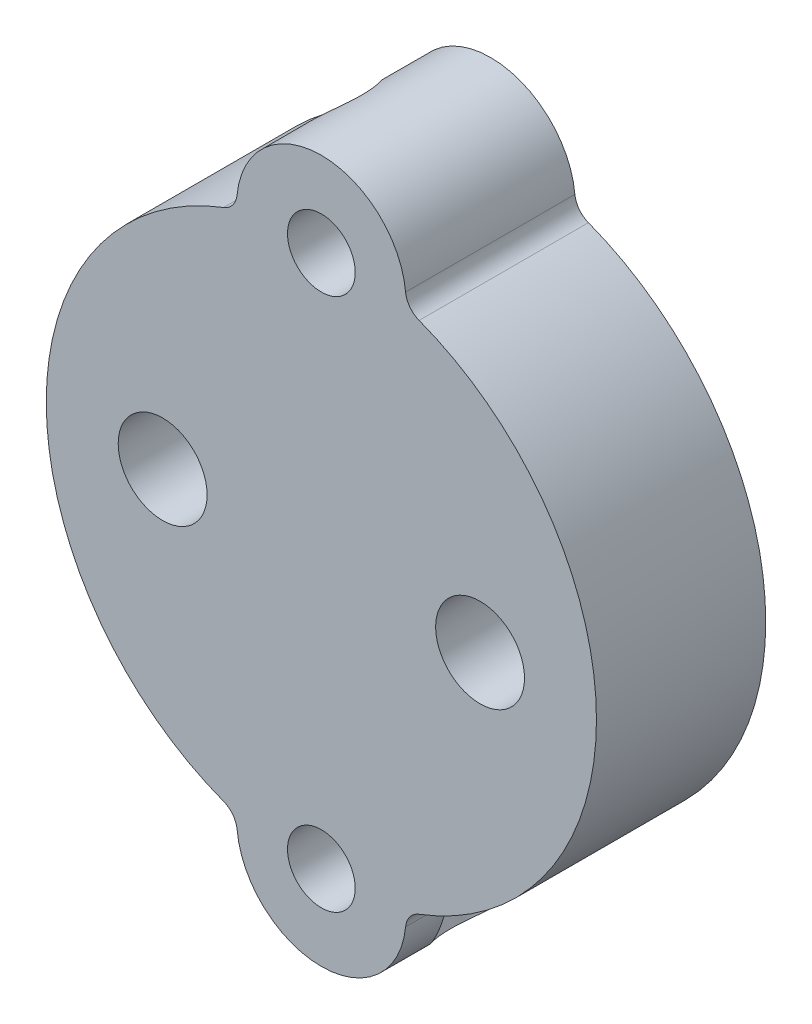
from build123d import *

# Parameters (mm, degrees)
SKETCH1_R               = 1.6
SKETCH1_R_2             = 2.1
BOSS_EXTRUDE1_DEPTH     = 8
CUT_EXTRUDE1_DEPTH      = 23.551274909
CUT_EXTRUDE1_DEPTH_BACK = 23.551274909
SKETCH3_R               = 2.1
CUT_EXTRUDE2_DEPTH      = 23.551275075
CUT_EXTRUDE2_DEPTH_BACK = 3
SKETCH4_R               = 3.4


with BuildPart() as part:
    # Sketch1 → Boss-Extrude1 (new body)
    with BuildSketch(Plane.XY):
        with BuildLine():
            ThreePointArc((4.62089851, -12.151020408), (13, 0), (4.62089851, 12.151020408))
            ThreePointArc((4.62089851, 12.151020408), (4.181690754, 12.478661471), (3.981081793, 12.988571429))
            ThreePointArc((3.981081793, 12.988571429), (0, 16.6), (-3.981081793, 12.988571429))
            ThreePointArc((-3.981081793, 12.988571429), (-4.181690754, 12.478661471), (-4.62089851, 12.151020408))
            ThreePointArc((-4.62089851, 12.151020408), (-13, 0), (-4.62089851, -12.151020408))
            ThreePointArc((-4.62089851, -12.151020408), (-4.181690754, -12.478661471), (-3.981081793, -12.988571429))
            ThreePointArc((-3.981081793, -12.988571429), (0, -16.6), (3.981081793, -12.988571429))
            ThreePointArc((3.981081793, -12.988571429), (4.181690754, -12.478661471), (4.62089851, -12.151020408))
        make_face()
        with Locations((0, 12.6)):
            Circle(SKETCH1_R, mode=Mode.SUBTRACT)
        with Locations((0, -12.6)):
            Circle(SKETCH1_R, mode=Mode.SUBTRACT)
        with Locations((7.5, 0)):
            Circle(SKETCH1_R_2, mode=Mode.SUBTRACT)
        with Locations((-7.5, 0)):
            Circle(SKETCH1_R_2, mode=Mode.SUBTRACT)
    extrude(amount=BOSS_EXTRUDE1_DEPTH)

    # Sketch3 → Cut-Extrude1 (cut, two sides: drawn at the far end of the back side and taken through both)
    with BuildSketch(Plane(origin=(0, 0, 0), x_dir=(0, 0, 1), z_dir=(-0.25881904510252135, 0.9659258262890681, 0)).offset(-CUT_EXTRUDE1_DEPTH_BACK)):
        with Locations((4, 0)):
            Circle(SKETCH3_R)
    extrude(amount=CUT_EXTRUDE1_DEPTH + CUT_EXTRUDE1_DEPTH_BACK, mode=Mode.SUBTRACT)

    # Sketch4 → Cut-Extrude2 (cut, two sides: drawn at the far end of the back side and taken through both)
    with BuildSketch(Plane(origin=(0, 0, 0), x_dir=(-1, 0, 0), z_dir=(0, 0, -1)).offset(-CUT_EXTRUDE2_DEPTH_BACK)):
        with Locations((-7.5, 0)):
            Circle(SKETCH4_R)
        with Locations((7.5, 0)):
            Circle(SKETCH4_R)
    extrude(amount=CUT_EXTRUDE2_DEPTH + CUT_EXTRUDE2_DEPTH_BACK, mode=Mode.SUBTRACT)


solid = part.part
